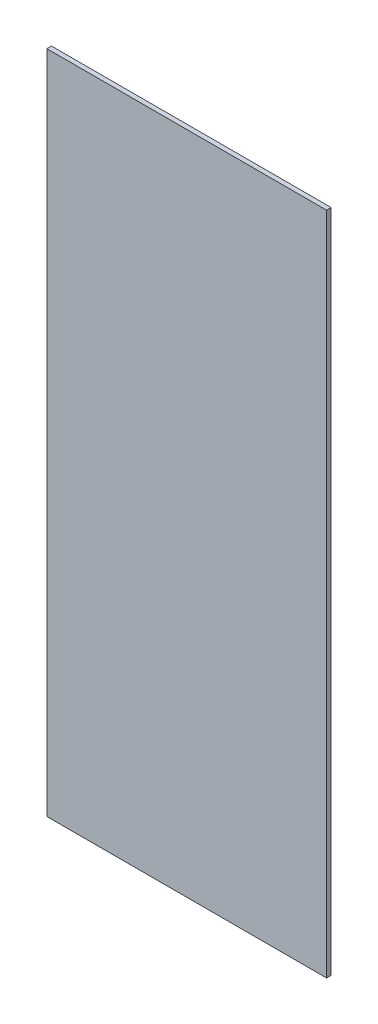
from build123d import *

# Parameters (mm, degrees)
SKETCH1_W           = 212
SKETCH1_H           = 290
BOSS_EXTRUDE1_DEPTH = 2
SKETCH2_W           = 143.399346135
SKETCH2_H           = 566.683423317
SKETCH2_W_2         = 183.476538337
SKETCH2_H_2         = 574.505000975
CUT_EXTRUDE1_DEPTH  = 180.624608559


with BuildPart() as part:
    # Sketch1 → Boss-Extrude1 (new body)
    with BuildSketch(Plane.XY):
        Rectangle(SKETCH1_W, SKETCH1_H)
    extrude(amount=BOSS_EXTRUDE1_DEPTH)

    # Sketch2 → Cut-Extrude1 (cut, through all)
    with BuildSketch(Plane(origin=(0, 0, 0), x_dir=(-1, 0, 0), z_dir=(0, 0, -1))):
        with Locations((-132.699673068, 31.379914175)):
            Rectangle(SKETCH2_W, SKETCH2_H)
        with Locations((152.738269169, -7.931429395)):
            Rectangle(SKETCH2_W_2, SKETCH2_H_2)
    extrude(amount=-CUT_EXTRUDE1_DEPTH, mode=Mode.SUBTRACT)


solid = part.part
